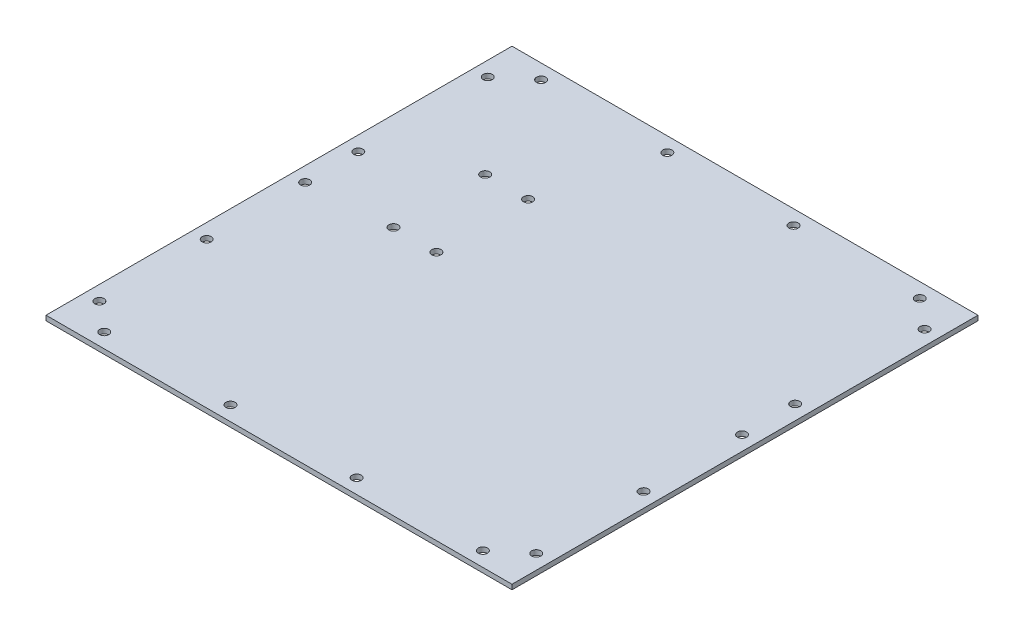
from build123d import *

# Parameters (mm, degrees)
SKETCH2_W             = 152.4
SKETCH2_H             = 152.4
BOSS_EXTRUDE1_DEPTH   = 1.5875
F_3_0MM_DOWEL_HOLE2_D = 3
F_3_0MM_DOWEL_HOLE3_D = 3
LPATTERN1_COUNT       = 4
LPATTERN1_PITCH       = 42.333333333
LPATTERN2_COUNT       = 4
LPATTERN2_PITCH       = 41.275
F_3_0MM_DOWEL_HOLE1_D = 3
SKETCH12_R            = 1.5
CUT_EXTRUDE1_DEPTH    = 10


with BuildPart() as part:
    # Sketch2 → Boss-Extrude1 (new body)
    with BuildSketch(Plane(origin=(0, 0, 0), x_dir=(1, 0, 0), z_dir=(0, 1, 0))):
        with Locations((76.2, 76.2)):
            Rectangle(SKETCH2_W, SKETCH2_H)
    extrude(amount=BOSS_EXTRUDE1_DEPTH)

    # Ø3.0mm Dowel Hole2 (through all)
    with Locations(Plane(origin=(0, 1.5875, 0), x_dir=(1, 0, 0), z_dir=(0, 1, 0))):
        with Locations((14.2875, 147.6375), (14.2875, 4.7625)):
            f_3_0mm_dowel_hole2 = Hole(F_3_0MM_DOWEL_HOLE2_D / 2)

    # Ø3.0mm Dowel Hole3 (through all)
    with Locations(Plane(origin=(0, 1.5875, 0), x_dir=(1, 0, 0), z_dir=(0, 1, 0))):
        with Locations((4.7625, 139.7), (147.6375, 139.7)):
            f_3_0mm_dowel_hole3 = Hole(F_3_0MM_DOWEL_HOLE3_D / 2)

    # LPattern1: Ø3.0mm Dowel Hole3 ×4, 1 skipped
    with Locations(*[(0, 0, i * LPATTERN1_PITCH) for i in range(1, LPATTERN1_COUNT) if i not in (2,)]):
        add(f_3_0mm_dowel_hole3, mode=Mode.SUBTRACT)

    # LPattern2: Ø3.0mm Dowel Hole2 ×4
    with Locations(*[(i * LPATTERN2_PITCH, 0, 0) for i in range(1, LPATTERN2_COUNT)]):
        add(f_3_0mm_dowel_hole2, mode=Mode.SUBTRACT)

    # Ø3.0mm Dowel Hole1 (through all)
    with Locations(Plane(origin=(0, 1.5875, 0), x_dir=(1, 0, 0), z_dir=(0, 1, 0))):
        with Locations((147.6375, 47.79), (147.6375, 80)):
            f_3_0mm_dowel_hole1 = Hole(F_3_0MM_DOWEL_HOLE1_D / 2)

    # Mirror1: Ø3.0mm Dowel Hole1 across plane
    add(f_3_0mm_dowel_hole1.mirror(Plane(origin=(76.2, 0, 0), x_dir=(0, 0, 1), z_dir=(1, 0, 0))), mode=Mode.SUBTRACT)

    # Sketch12 → Cut-Extrude1 (cut)
    with BuildSketch(Plane(origin=(0, 1.5875, 0), x_dir=(1, 0, 0), z_dir=(0, 1, 0))):
        with Locations((31.949376953, 111.680603298)):
            Circle(SKETCH12_R)
        with Locations((45.999376953, 111.680603298)):
            Circle(SKETCH12_R)
        with Locations((31.949376953, 81.680603298)):
            Circle(SKETCH12_R)
        with Locations((45.999376953, 81.680603298)):
            Circle(SKETCH12_R)
    extrude(amount=-CUT_EXTRUDE1_DEPTH, mode=Mode.SUBTRACT)


solid = part.part
